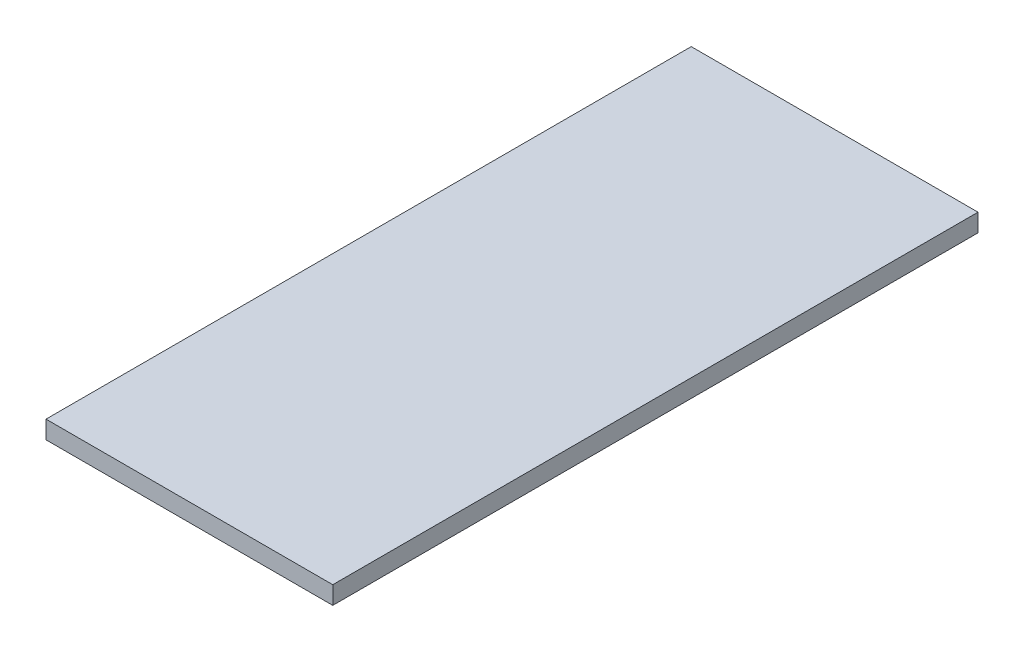
from build123d import *

# Parameters (mm, degrees)
SKETCH1_W           = 101.6
SKETCH1_H           = 6.35
BOSS_EXTRUDE1_DEPTH = 228.6


with BuildPart() as part:
    # Sketch1 → Boss-Extrude1 (new body)
    with BuildSketch(Plane.XY):
        Rectangle(SKETCH1_W, SKETCH1_H)
    extrude(amount=BOSS_EXTRUDE1_DEPTH)


solid = part.part
